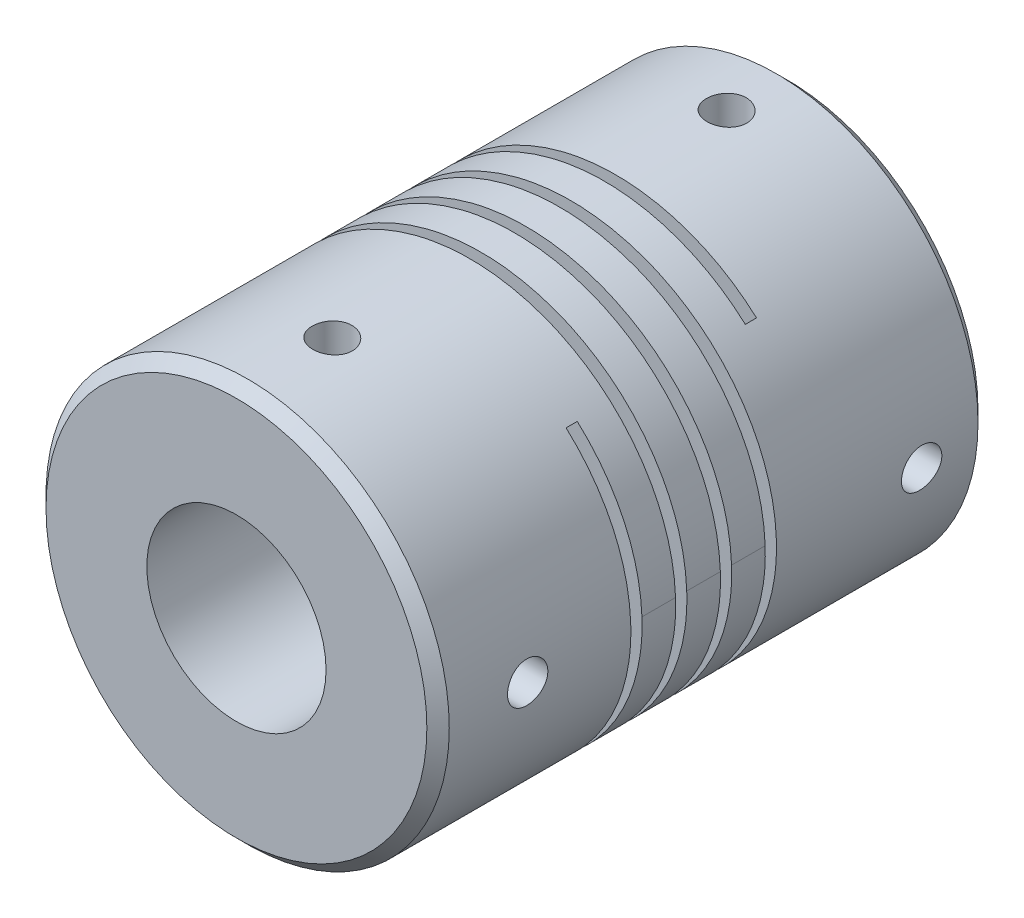
from build123d import *

# Parameters (mm, degrees)
SKETCH1_R               = 9
SKETCH1_R_2             = 4
BOSS_EXTRUDE1_DEPTH     = 24.6
CUT_SWEEP2_PITCH        = 2
CUT_EXTRUDE2_REACH      = 33.783
CUT_EXTRUDE2_END_RADIUS = 4
SKETCH6_R               = 0.9
CUT_EXTRUDE3_REACH      = 33.783
CUT_EXTRUDE3_END_RADIUS = 4
SKETCH7_R               = 0.9
CHANFREIN1_SIZE         = 0.5


with BuildPart() as part:
    # Sketch1 → Boss-Extrude1 (new body)
    with BuildSketch(Plane.XY):
        Circle(SKETCH1_R)
        Circle(SKETCH1_R_2, mode=Mode.SUBTRACT)
    extrude(amount=BOSS_EXTRUDE1_DEPTH)

    # Cut-Sweep2: arcs per turn and ends read off the stored shape
    # Cut-Sweep2: the profile of Sketch5 screwed along a right-hand helix through 4 turns, 10 arcs to a turn; built about Z, then put on its axis
    cut_sweep2_z = Axis((0, 0, 0), (0, 0, 1))
    cut_sweep2_corners = [(10, 0, -3.25), (10, 0, -2.75), (-2, 0, -2.75), (-2, 0, -3.25)]
    with BuildLine(mode=Mode.PRIVATE) as cut_sweep2_profile:
        Line(cut_sweep2_corners[0], cut_sweep2_corners[1])
        Line(cut_sweep2_corners[1], cut_sweep2_corners[2])
        Line(cut_sweep2_corners[2], cut_sweep2_corners[3])
        Line(cut_sweep2_corners[3], cut_sweep2_corners[0])
    cut_sweep2_cap = Face(cut_sweep2_profile.wire())
    cut_sweep2_turn_angles = [0, 18, 36, 54, 72, 90, 108, 126, 144, 162, 180, 198, 216, 234, 252, 270, 288, 306, 324, 342, 360]
    cut_sweep2_turn_weights = [1, 0.9510565162951535, 1, 0.9510565162951535, 1, 0.9510565162951535, 1, 0.9510565162951535, 1, 0.9510565162951535, 1, 0.9510565162951535, 1, 0.9510565162951535, 1, 0.9510565162951535, 1, 0.9510565162951535, 1, 0.9510565162951535, 1]
    cut_sweep2_turn_rails = [Edge.make_bspline([Vector(p[0], p[1], 0).rotate(cut_sweep2_z, cut_sweep2_turn_angles[k]) / cut_sweep2_turn_weights[k] + Vector(0, 0, p[2] + CUT_SWEEP2_PITCH * cut_sweep2_turn_angles[k] / 360) for k in range(21)], [0, 0, 0, 1, 1, 2, 2, 3, 3, 4, 4, 5, 5, 6, 6, 7, 7, 8, 8, 9, 9, 10, 10, 10], 2, cut_sweep2_turn_weights) for p in cut_sweep2_corners]
    cut_sweep2_turn_sides = [Face.make_surface_from_curves(cut_sweep2_turn_rails[p[0]], cut_sweep2_turn_rails[p[1]]) for p in [(0, 1), (1, 2), (2, 3), (3, 0)]]
    cut_sweep2 = Plane(origin=(0, 0, 11), x_dir=(0.7071067811865512, 0.7071067811865438, 0), z_dir=(0, 0, 1)) * Solid(Shell([*[p.moved(Location((0, 0, CUT_SWEEP2_PITCH * i))) for i in range(4) for p in cut_sweep2_turn_sides], cut_sweep2_cap, cut_sweep2_cap.rotate(cut_sweep2_z, 1440).moved(Location((0, 0, CUT_SWEEP2_PITCH * 1440 / 360)))]))
    add(cut_sweep2, mode=Mode.SUBTRACT)

    # Cut-Extrude2: up to this cylinder (the profile starts outside it)
    cut_extrude2_end = Plane(origin=(0, 0, 11.8), z_dir=(0, 0, -1)) * Cylinder(CUT_EXTRUDE2_END_RADIUS, 94.166, mode=Mode.PRIVATE)
    # Sketch6 → Cut-Extrude2 (cut, up to the surface)
    with BuildSketch(Plane(origin=(0, 9, 0), x_dir=(1, 0, 0), z_dir=(0, 1, 0)), mode=Mode.PRIVATE) as cut_extrude2_sk1:
        with Locations(Location((0.277829575, -20.6, 0), (0, 0, 270))):
            Circle(SKETCH6_R)
    cut_extrude2_tool1 = extrude(cut_extrude2_sk1.sketch, amount=-CUT_EXTRUDE2_REACH, mode=Mode.PRIVATE) - cut_extrude2_end
    add(cut_extrude2_tool1.solids().sort_by_distance((0.27783, 9, 20.6))[0], mode=Mode.SUBTRACT)
    # Sketch6 → Cut-Extrude2 (cut, up to the surface)
    with BuildSketch(Plane(origin=(0, 9, 0), x_dir=(1, 0, 0), z_dir=(0, 1, 0)), mode=Mode.PRIVATE) as cut_extrude2_sk2:
        with Locations(Location((0.277829575, -3, 0), (0, 0, 270))):
            Circle(SKETCH6_R)
    cut_extrude2_tool2 = extrude(cut_extrude2_sk2.sketch, amount=-CUT_EXTRUDE2_REACH, mode=Mode.PRIVATE) - cut_extrude2_end
    add(cut_extrude2_tool2.solids().sort_by_distance((0.27783, 9, 3))[0], mode=Mode.SUBTRACT)

    # Cut-Extrude3: up to this cylinder (the profile starts outside it)
    cut_extrude3_end = Plane(origin=(0, 0, 11.8), z_dir=(0, 0, -1)) * Cylinder(CUT_EXTRUDE3_END_RADIUS, 94.166, mode=Mode.PRIVATE)
    # Sketch7 → Cut-Extrude3 (cut, up to the surface)
    with BuildSketch(Plane(origin=(9, 0, 0), x_dir=(0, 0, -1), z_dir=(1, 0, 0)), mode=Mode.PRIVATE) as cut_extrude3_sk1:
        with Locations((-20.6, 0)):
            Circle(SKETCH7_R)
    cut_extrude3_tool1 = extrude(cut_extrude3_sk1.sketch, amount=-CUT_EXTRUDE3_REACH, mode=Mode.PRIVATE) - cut_extrude3_end
    add(cut_extrude3_tool1.solids().sort_by_distance((9, 0, 20.6))[0], mode=Mode.SUBTRACT)
    # Sketch7 → Cut-Extrude3 (cut, up to the surface)
    with BuildSketch(Plane(origin=(9, 0, 0), x_dir=(0, 0, -1), z_dir=(1, 0, 0)), mode=Mode.PRIVATE) as cut_extrude3_sk2:
        with Locations((-3, -0.51732007)):
            Circle(SKETCH7_R)
    cut_extrude3_tool2 = extrude(cut_extrude3_sk2.sketch, amount=-CUT_EXTRUDE3_REACH, mode=Mode.PRIVATE) - cut_extrude3_end
    add(cut_extrude3_tool2.solids().sort_by_distance((9, -0.51732, 3))[0], mode=Mode.SUBTRACT)

    # Chanfrein1
    chanfrein1_edges = [part.edges().sort_by_distance(p)[0] for p in [
        (-9, 0, 24.6),
        (-9, 0, 0),
    ]]
    chamfer(chanfrein1_edges, length=CHANFREIN1_SIZE)


solid = part.part
